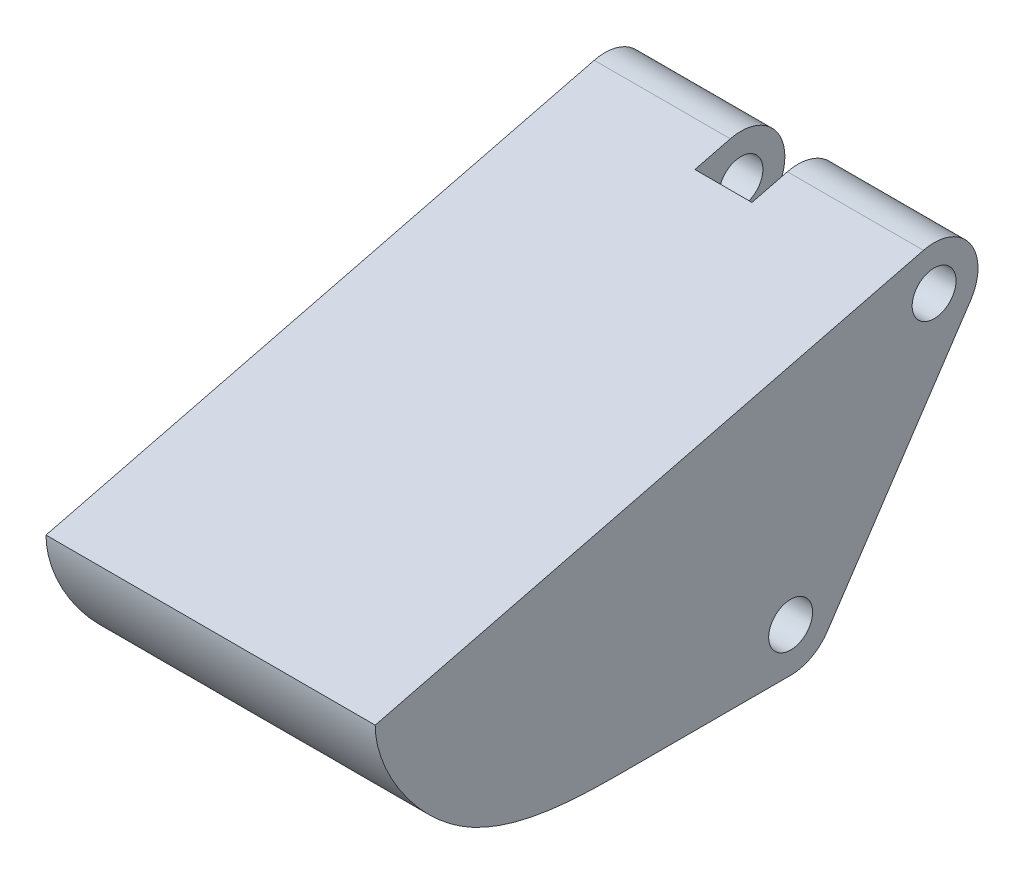
from build123d import *

# Parameters (mm, degrees)
SKETCH2_R           = 1
BOSS_EXTRUDE1_DEPTH = 7.5
SKETCH4_W           = 2.6
SKETCH4_H           = 4.1
CUT_EXTRUDE1_DEPTH  = 15
CUT_EXTRUDE3_DEPTH  = 4


with BuildPart() as part:
    # Sketch2 → Boss-Extrude1 (new, symmetric)
    with BuildSketch(Plane(origin=(0, 0, 0), x_dir=(0, 0, -1), z_dir=(1, 0, 0))):
        with BuildLine():
            ThreePointArc((-2.869582682, 3.195625977), (-2.89885215, 5.457123243), (-5.018754521, 6.24531137))
            Line((-5.018754521, 6.24531137), (-30, 0))
            add(Edge.make_bspline(
                [(-30, 0), (-30, -1.862010614), (-26.296905553, -7.670881077), (-20.233591891, -7.5), (-18, -7.5)],
                knots=[0, 0, 0, 0, 0.469762973, 1, 1, 1, 1], degree=3))
            Line((-18, -7.5), (-11.070367517, -7.5))
            ThreePointArc((-11.070367517, -7.5), (-10.126651666, -7.263349198), (-9.406266928, -6.609400392))
            Line((-9.406266928, -6.609400392), (-2.869582682, 3.195625977))
        make_face()
        with Locations((-11.070367517, -5.5)):
            Circle(SKETCH2_R, mode=Mode.SUBTRACT)
        with Locations((-4.533683271, 4.30502637)):
            Circle(SKETCH2_R, mode=Mode.SUBTRACT)
    extrude(amount=BOSS_EXTRUDE1_DEPTH, both=True)

    # Sketch4 → Cut-Extrude1 (cut)
    with BuildSketch(Plane(origin=(0, 6.30502637, 0), x_dir=(1, 0, 0), z_dir=(0, 1, 0))):
        with Locations((0, -4.583683271)):
            Rectangle(SKETCH4_W, SKETCH4_H)
    extrude(amount=-CUT_EXTRUDE1_DEPTH, mode=Mode.SUBTRACT)

    # Sketch5 → Cut-Extrude3 (cut)
    with BuildSketch(Plane.XZ.offset(7.5)):
        with BuildLine():
            Line((5, 7.070367517), (-5, 7.070367517))
            Line((-5, 7.070367517), (-5, 14.070367517))
            ThreePointArc((-5, 14.070367517), (0, 16.753742727), (5, 14.070367517))
            Line((5, 14.070367517), (5, 7.070367517))
        make_face()
    extrude(amount=-CUT_EXTRUDE3_DEPTH, mode=Mode.SUBTRACT)


solid = part.part
